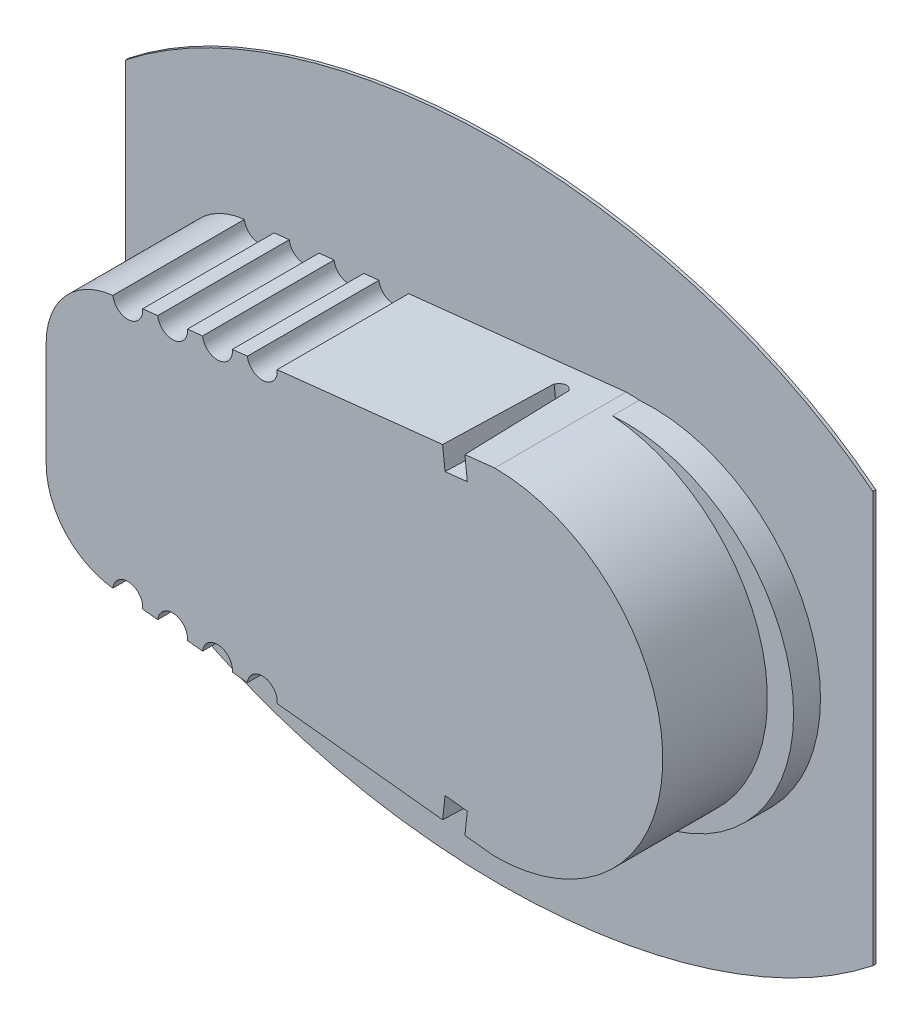
from build123d import *

# Parameters (mm, degrees)
SENSOR_HEIGHT_DEPTH               = 9
SENSOR_LIP_HEIGHT_DEPTH           = 2
SHORT_SIDE_EDGE_ROUNDING_R        = 5
PATCH_DEPTH                       = 0.2
SENSOR_HOLES_R                    = 1
EXTRUDED_SENSOR_HOLES_DEPTH       = 8.8
BOTTOM_TRIANGLE_CUT_DEPTH         = 1.5
TOP_TRIANGLE_CUT_DEPTH            = 1.5
FILAMENT_HOLE_CUT_DEPTH           = 2.5
FILAMENT_PROFILE_R                = 0.175
SENSING_START                     = -1.8
SENSING_FILAMENT_R                = 0.175
SENSING_FILAMENT_R_2              = 0.15
SENSING_PORTION_OF_FILAMENT_DEPTH = 1.8


# Read off the part's stored shape, not the designer's step: Sensor Lip Height
with BuildPart() as part:
    # Basic Sensor Dimensions → Sensor Height (new body)
    with BuildSketch(Plane.XY):
        with BuildLine():
            Line((-21.5, 8), (-21.5, -8))
            Line((-21.5, -8), (8.5, -11.25))
            ThreePointArc((8.5, -11.25), (19.75, 0), (8.5, 11.25))
            Line((8.5, 11.25), (-21.5, 8))
        make_face()
    extrude(amount=SENSOR_HEIGHT_DEPTH)

    # Sensor Lip Height outline → Sensor Lip Height (add)
    with BuildSketch(Plane.XY):
        with BuildLine():
            ThreePointArc((9.375, -11.215920604), (21.5, 0), (9.375, 11.215920604))
            ThreePointArc((9.375, 11.215920604), (19.75, 0), (9.375, -11.215920604))
        make_face()
    extrude(amount=SENSOR_LIP_HEIGHT_DEPTH)

    # Short Side Edge Rounding
    short_side_edge_rounding_edges = [part.edges().sort_by_distance(p)[0] for p in [
        (-21.5, -8, 4.5),
        (-21.5, 8, 4.5),
    ]]
    fillet(short_side_edge_rounding_edges, radius=SHORT_SIDE_EDGE_ROUNDING_R)

    # Basic Sensor Dimensions<7> → Patch (add)
    with BuildSketch(Plane.XY):
        with BuildLine():
            Line((25, 13.737877927), (25, -13.737877927))
            add(Edge.make_bspline(
                [(-25, -13.737877927), (0, -33.647845937), (25, -13.737877927)],
                knots=[3.834752561, 3.834752561, 3.834752561, 5.5900254, 5.5900254, 5.5900254], degree=2, weights=[1, 0.638971066, 1]))
            Line((-25, -13.737877927), (-25, 13.737877927))
            add(Edge.make_bspline(
                [(25, 13.737877927), (0, 33.647845937), (-25, 13.737877927)],
                knots=[0.693159908, 0.693159908, 0.693159908, 2.448432746, 2.448432746, 2.448432746], degree=2, weights=[1, 0.638971066, 1]))
        make_face()
    extrude(amount=PATCH_DEPTH)

    # Sensor Holes → Extruded Sensor Holes (cut)
    with BuildSketch(Plane.XY.offset(9)):
        with Locations((-16.044332748, -8.591030619)):
            Circle(SENSOR_HOLES_R)
        with Locations((-13.044332748, -8.916030619)):
            Circle(SENSOR_HOLES_R)
        with Locations((-10.044332748, -9.241030619)):
            Circle(SENSOR_HOLES_R)
        with Locations((-7.044332748, -9.566030619)):
            Circle(SENSOR_HOLES_R)
        with Locations((-10.044332748, 9.241030619)):
            Circle(SENSOR_HOLES_R)
        with Locations((-7.044332748, 9.566030619)):
            Circle(SENSOR_HOLES_R)
        with Locations((-13.044332748, 8.916030619)):
            Circle(SENSOR_HOLES_R)
        with Locations((-16.044332748, 8.591030619)):
            Circle(SENSOR_HOLES_R)
    extrude(amount=-EXTRUDED_SENSOR_HOLES_DEPTH, mode=Mode.SUBTRACT)

    # Bottom Triangle → Bottom Triangle Cut (cut)
    with BuildSketch(Plane(origin=(-1.106012767, -10.209348617, 0), x_dir=(0.9941830955390242, -0.10770316868339427, 0), z_dir=(-0.10770316868339427, -0.9941830955390242, 0))):
        with BuildLine():
            Line((6.91221696, 1.5), (6.91221696, 9))
            Line((6.91221696, 9), (6.16221696, 9))
            Line((6.16221696, 9), (6.41221696, 1.790726708))
            add(Edge.make_bspline(
                [(6.41221696, 1.790726708), (6.66221696, 1.5), (6.91221696, 1.5)],
                knots=[0, 0, 0, 0.5, 0.5, 0.5], degree=2))
        make_face()
        with BuildLine():
            Line((7.41221696, 1.790726708), (7.66221696, 9))
            Line((7.66221696, 9), (6.91221696, 9))
            Line((6.91221696, 9), (6.91221696, 1.5))
            add(Edge.make_bspline(
                [(6.91221696, 1.5), (7.16221696, 1.5), (7.41221696, 1.790726708)],
                knots=[0.5, 0.5, 0.5, 1, 1, 1], degree=2))
        make_face()
    extrude(amount=-BOTTOM_TRIANGLE_CUT_DEPTH, mode=Mode.SUBTRACT)

    # Top Triangle → Top Triangle Cut (cut)
    with BuildSketch(Plane(origin=(-1.106012767, 10.209348617, 0), x_dir=(0.9941830955390242, 0.10770316868339432, 0), z_dir=(-0.10770316868339432, 0.9941830955390242, 0))):
        with BuildLine():
            Line((6.91221696, -9), (7.66221696, -9))
            Line((7.66221696, -9), (7.41221696, -1.790726708))
            add(Edge.make_bspline(
                [(6.91221696, -1.5), (7.16221696, -1.5), (7.41221696, -1.790726708)],
                knots=[0.5, 0.5, 0.5, 1, 1, 1], degree=2))
            Line((6.91221696, -1.5), (6.91221696, -9))
        make_face()
        with BuildLine():
            Line((6.16221696, -9), (6.91221696, -9))
            Line((6.91221696, -9), (6.91221696, -1.5))
            add(Edge.make_bspline(
                [(6.41221696, -1.790726708), (6.66221696, -1.5), (6.91221696, -1.5)],
                knots=[0, 0, 0, 0.5, 0.5, 0.5], degree=2))
            Line((6.41221696, -1.790726708), (6.16221696, -9))
        make_face()
    extrude(amount=-TOP_TRIANGLE_CUT_DEPTH, mode=Mode.SUBTRACT)

    # Filament Hole → Filament Hole Cut (cut)
    with BuildSketch(Plane(origin=(0, 0, 0), x_dir=(-1, 0, 0), z_dir=(0, 0, -1))):
        with BuildLine():
            Line((4.5, 1), (1.5, 1))
            Line((1.5, 1), (1.5, -1))
            Line((1.5, -1), (4.5, -1))
            ThreePointArc((4.5, -1), (5.5, 0), (4.5, 1))
        make_face()
    extrude(amount=-FILAMENT_HOLE_CUT_DEPTH, mode=Mode.SUBTRACT)

    # Filament: sweep along a curve in space
    with BuildLine() as filament_path:
        Line((-3.5, 0, 0), (-3.5, 0, 2.5))
        Line((-3.5, 0, 0), (5.59326674, 0, -5.25))
    # Filament profile (on start of the path) → Filament (sweep)
    with BuildSketch(Plane(origin=(5.59326674, 0, -5.25), x_dir=(-0.500000000000001, 0, -0.866025403784438), z_dir=(-0.866025403784438, -1.4044495267806857e-15, 0.500000000000001))):
        Circle(FILAMENT_PROFILE_R)
    sweep(path=filament_path.line, transition=Transition.RIGHT)

    # Sensing Filament → Sensing Portion of Filament (cut)
    with BuildSketch(Plane(origin=(6.46826674, 0, -3.734455543), x_dir=(-0.500000000000001, 0, -0.866025403784438), z_dir=(0.866025403784438, 1.066393786355781e-15, -0.500000000000001)).offset(SENSING_START)):
        with Locations((1.75, 0)):
            Circle(SENSING_FILAMENT_R)
        with Locations((1.75, 0)):
            Circle(SENSING_FILAMENT_R_2, mode=Mode.SUBTRACT)
    extrude(amount=SENSING_PORTION_OF_FILAMENT_DEPTH, mode=Mode.SUBTRACT)


solid = part.part
